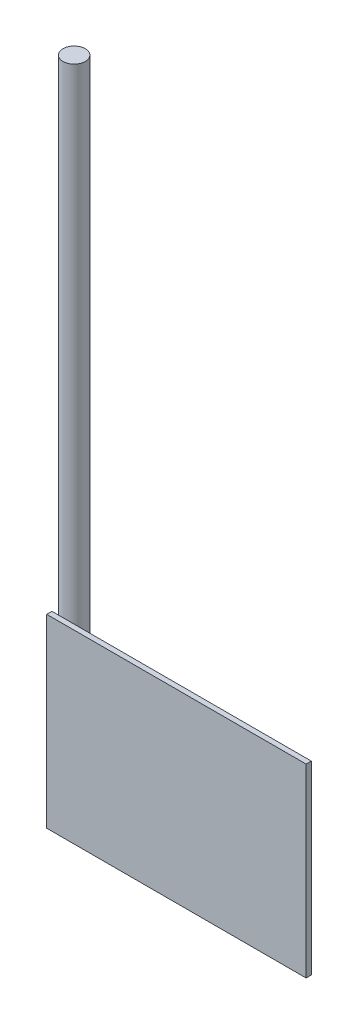
from build123d import *

# Parameters (mm, degrees)
SKETCH1_W           = 35
SKETCH1_H           = 25
BASE_FLANGE1_DEPTH  = 0.7
SKETCH6_R           = 1.5
BOSS_EXTRUDE1_DEPTH = 90


# Sheet-metal steps are written as plain solids
with BuildPart() as part:
    # Sketch1 → Base-Flange1 (new body)
    with BuildSketch(Plane.XY):
        Rectangle(SKETCH1_W, SKETCH1_H)
    extrude(amount=-BASE_FLANGE1_DEPTH)


with BuildPart() as body_2:
    # Sketch6 → Boss-Extrude1 (new body)
    with BuildSketch(Plane(origin=(0, -12.5, 0), x_dir=(1, 0, 0), z_dir=(0, 1, 0))):
        with Locations(Location((-16, 2.2, 0), (0, 0, 90))):
            Circle(SKETCH6_R)
    extrude(amount=BOSS_EXTRUDE1_DEPTH)


solid = Compound([part.part, body_2.part])
